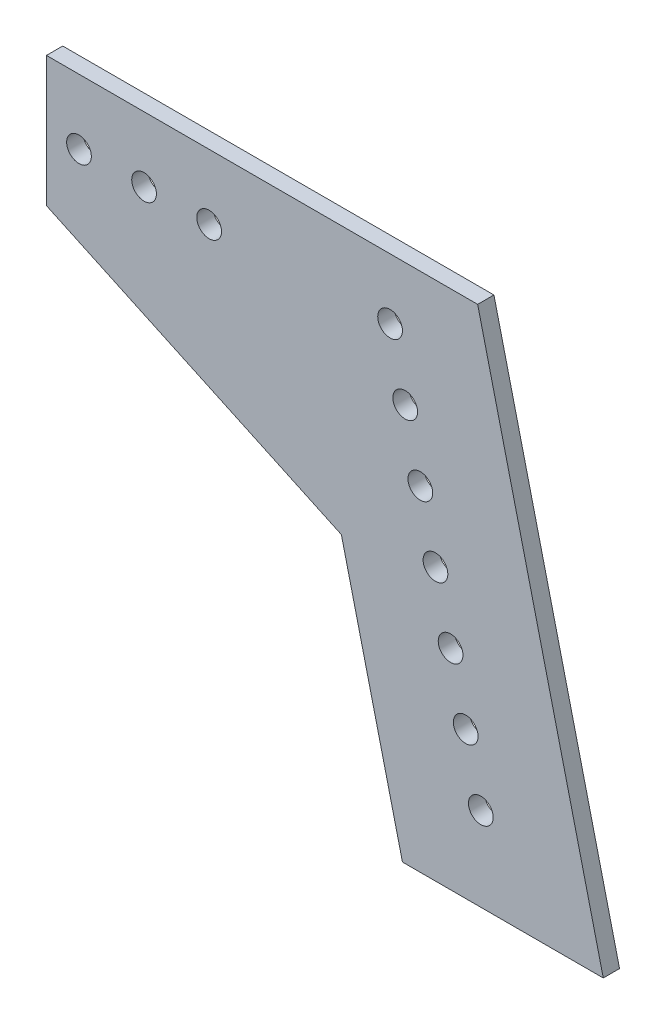
from build123d import *

# Parameters (mm, degrees)
SKETCH1_W           = 381
SKETCH1_H           = 177.8
BOSS_EXTRUDE1_DEPTH = 3.175
CUT_EXTRUDE1_DEPTH  = 211.246380766
CUT_EXTRUDE2_DEPTH  = 211.246380766
CUT_EXTRUDE3_DEPTH  = 211.246380766
SKETCH9_R           = 2.413
CUT_EXTRUDE5_DEPTH  = 203.001417808
CUT_EXTRUDE6_DEPTH  = 203.001417808
CUT_EXTRUDE7_DEPTH  = 193.181197823
SKETCH12_R          = 2.413
CUT_EXTRUDE8_DEPTH  = 151.259355371


with BuildPart() as part:
    # Sketch1 → Boss-Extrude1 (new body)
    with BuildSketch(Plane.XY):
        Rectangle(SKETCH1_W, SKETCH1_H)
    extrude(amount=BOSS_EXTRUDE1_DEPTH)

    # Sketch3 → Cut-Extrude1 (cut, through all)
    with BuildSketch(Plane(origin=(0, 0, 0), x_dir=(-1, 0, 0), z_dir=(0, 0, -1))):
        Polygon((-190.5, 88.9), (-99.370844131, 88.9), (-190.5, -288.755692739), align=None)
        Polygon((258.630794567, 88.9), (156.501034438, 88.9), (258.630794567, -334.344185156), align=None)
    extrude(amount=-CUT_EXTRUDE1_DEPTH, mode=Mode.SUBTRACT)

    # Sketch4 → Cut-Extrude2 (cut, through all)
    with BuildSketch(Plane(origin=(0, 0, 0), x_dir=(-1, 0, 0), z_dir=(0, 0, -1))):
        Polygon((201.948976875, -63.5), (-149.057902373, -63.5), (-154.480371301, -88.9), (207.162724281, -88.9), align=None)
    extrude(amount=-CUT_EXTRUDE2_DEPTH, mode=Mode.SUBTRACT)

    # Sketch8 → Cut-Extrude3 (cut, through all)
    with BuildSketch(Plane(origin=(0, 0, 0), x_dir=(-1, 0, 0), z_dir=(0, 0, -1))):
        Polygon((-96.951775135, -63.5), (-85.032410439, -14.118133437), (194.367589561, -14.118133437), (206.286954257, -63.5), align=None)
    extrude(amount=-CUT_EXTRUDE3_DEPTH, mode=Mode.SUBTRACT)

    # Sketch9 → Cut-Extrude5 (cut, through all)
    with BuildSketch(Plane(origin=(0, 0, 0), x_dir=(-1, 0, 0), z_dir=(0, 0, -1))):
        with Locations((-112.248866809, -47.11699111)):
            Circle(SKETCH9_R)
        with Locations((-109.296836645, -34.883244559)):
            Circle(SKETCH9_R)
        with Locations((-106.344806482, -22.649498008)):
            Circle(SKETCH9_R)
        with Locations((-103.392776319, -10.415751457)):
            Circle(SKETCH9_R)
        with Locations((-100.440746156, 1.817995094)):
            Circle(SKETCH9_R)
        with Locations((-97.488715992, 14.051741645)):
            Circle(SKETCH9_R)
        with Locations((-94.536685829, 26.285488196)):
            Circle(SKETCH9_R)
        with Locations((-85.680595339, 62.986727849)):
            Circle(SKETCH9_R)
        with Locations((-82.728565176, 75.2204744)):
            Circle(SKETCH9_R)
    extrude(amount=-CUT_EXTRUDE5_DEPTH, mode=Mode.SUBTRACT)

    # Sketch10 → Cut-Extrude6 (cut, through all)
    with BuildSketch(Plane(origin=(0, 0, 0), x_dir=(-1, 0, 0), z_dir=(0, 0, -1))):
        Polygon((-99.370844131, 88.9), (-111.628996748, 38.1), (168.759187052, 38.1), (156.501034438, 88.9), align=None)
    extrude(amount=-CUT_EXTRUDE6_DEPTH, mode=Mode.SUBTRACT)

    # Sketch11 → Cut-Extrude7 (cut, through all)
    with BuildSketch(Plane(origin=(0, 0, 0), x_dir=(-1, 0, 0), z_dir=(0, 0, -1))):
        Polygon((-85.032410439, -14.118133437), (-27.473417058, 12.7), (-27.473417058, 38.1), (60.959223321, 38.1), (169.910337867, 38.1), (200.791231683, -67.495182141), (145.167714647, -67.495182141), (132.284027695, -14.118133437), align=None)
    extrude(amount=-CUT_EXTRUDE7_DEPTH, mode=Mode.SUBTRACT)

    # Sketch12 → Cut-Extrude8 (cut, through all)
    with BuildSketch(Plane(origin=(0, 0, 0), x_dir=(-1, 0, 0), z_dir=(0, 0, -1))):
        with Locations((-33.823417058, 25.4)):
            Circle(SKETCH12_R)
        with Locations((-46.523417058, 25.4)):
            Circle(SKETCH12_R)
        with Locations((-59.223417058, 25.4)):
            Circle(SKETCH12_R)
    extrude(amount=-CUT_EXTRUDE8_DEPTH, mode=Mode.SUBTRACT)


solid = part.part
